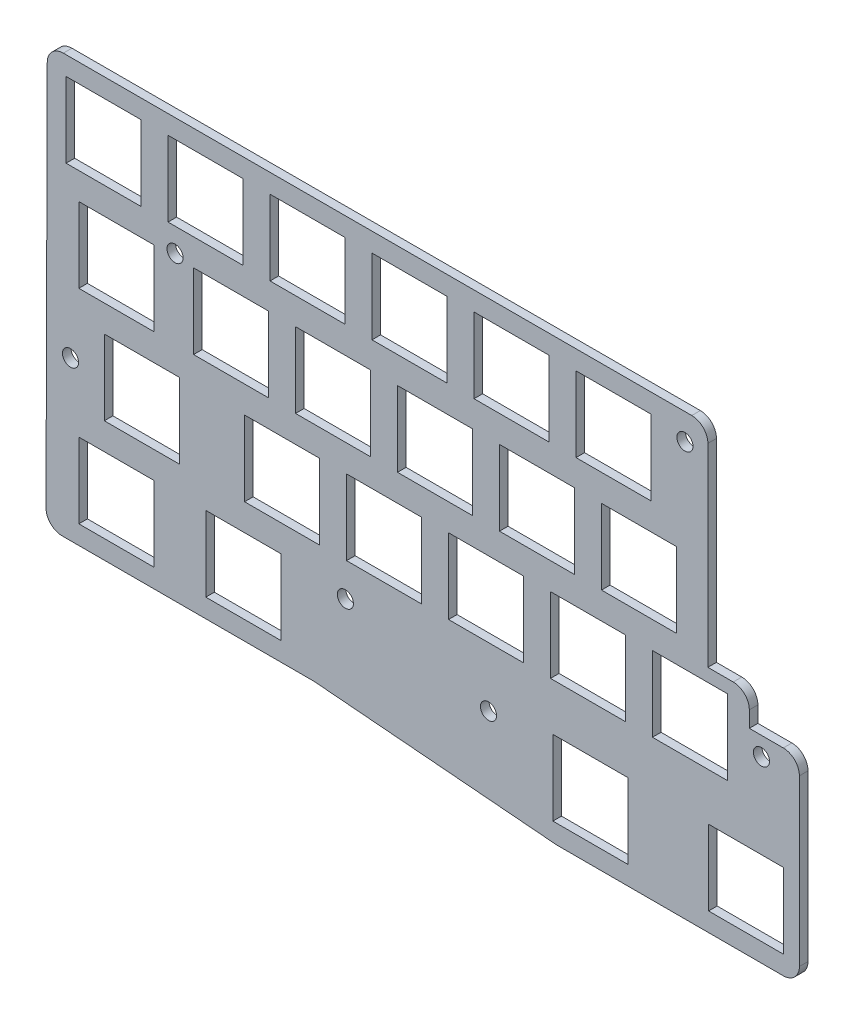
from build123d import *

# Parameters (mm, degrees)
SKETCH1_R           = 1.5
SKETCH1_W           = 14
SKETCH1_H           = 14
BOSS_EXTRUDE1_DEPTH = 1.6
CUT_EXTRUDE1_DEPTH  = 1.6
FILLET1_R           = 3


with BuildPart() as part:
    # Sketch1 → Boss-Extrude1 (new body)
    with BuildSketch(Plane.XY):
        with BuildLine():
            Line((69.256483633, 39.154946315), (-80.703110167, 39.058787515))
            ThreePointArc((-80.703110167, 39.058787515), (-82.819785745, 38.18282616), (-83.701171171, 36.068403419))
            Line((-83.701171171, 36.068403419), (-83.931946571, -35.933513481))
            ThreePointArc((-83.931946571, -35.933513481), (-83.056679124, -38.061046878), (-80.931961975, -38.943128786))
            Line((-80.931961975, -38.943128786), (-34.162352475, -38.943128786))
            ThreePointArc((-34.162352475, -38.943128786), (-34.036703471, -38.945761219), (-33.911274976, -38.953653901))
            Line((-33.911274976, -38.953653901), (11.083089424, -42.732603701))
            ThreePointArc((11.083089424, -42.732603701), (11.20851792, -42.740496382), (11.334166924, -42.743128815))
            Line((11.334166924, -42.743128815), (59.596129524, -42.743128815))
            ThreePointArc((59.596129524, -42.743128815), (61.35026035, -42.176855395), (62.442179406, -40.69181219))
            Line((62.442179406, -40.69181219), (72.104457106, -11.70497919))
            ThreePointArc((72.104457106, -11.70497919), (72.219669608, -11.236842575), (72.258407243, -10.756295796))
            Line((72.258407243, -10.756295796), (72.258407243, 36.154946904))
            ThreePointArc((72.258407243, 36.154946904), (71.379047386, 38.276947252), (69.256483633, 39.154946315))
        make_face()
        with Locations((35.108407229, 34.256871219)):
            Circle(SKETCH1_R, mode=Mode.SUBTRACT)
        with Locations((-28.161592771, -22.743128781)):
            Circle(SKETCH1_R, mode=Mode.SUBTRACT)
        with Locations((-1.491592771, -27.493128781)):
            Circle(SKETCH1_R, mode=Mode.SUBTRACT)
        with Locations((-79.366592771, -9.443128781)):
            Circle(SKETCH1_R, mode=Mode.SUBTRACT)
        with Locations((49.358407229, -9.443128781)):
            Circle(SKETCH1_R, mode=Mode.SUBTRACT)
        with Locations((-59.891592771, 17.156871219)):
            Circle(SKETCH1_R, mode=Mode.SUBTRACT)
        with Locations((2.808407229, 28.556871219)):
            Rectangle(SKETCH1_W, SKETCH1_H, mode=Mode.SUBTRACT)
        with Locations((21.808407229, 28.556871219)):
            Rectangle(SKETCH1_W, SKETCH1_H, mode=Mode.SUBTRACT)
        with Locations((-35.191592771, 28.556871219)):
            Rectangle(SKETCH1_W, SKETCH1_H, mode=Mode.SUBTRACT)
        with Locations((-16.191592771, 28.556871219)):
            Rectangle(SKETCH1_W, SKETCH1_H, mode=Mode.SUBTRACT)
        with Locations((-70.816592771, 9.556871219)):
            Rectangle(SKETCH1_W, SKETCH1_H, mode=Mode.SUBTRACT)
        with Locations((-49.441592771, 9.556871219)):
            Rectangle(SKETCH1_W, SKETCH1_H, mode=Mode.SUBTRACT)
        with Locations((-30.441592771, 9.556871219)):
            Rectangle(SKETCH1_W, SKETCH1_H, mode=Mode.SUBTRACT)
        with Locations((-11.441592771, 9.556871219)):
            Rectangle(SKETCH1_W, SKETCH1_H, mode=Mode.SUBTRACT)
        with Locations((-39.941592771, -9.443128781)):
            Rectangle(SKETCH1_W, SKETCH1_H, mode=Mode.SUBTRACT)
        with Locations((-1.941592771, -9.443128781)):
            Rectangle(SKETCH1_W, SKETCH1_H, mode=Mode.SUBTRACT)
        with Locations((26.558407229, 9.556871219)):
            Rectangle(SKETCH1_W, SKETCH1_H, mode=Mode.SUBTRACT)
        with Locations((36.058407229, -9.443128781)):
            Rectangle(SKETCH1_W, SKETCH1_H, mode=Mode.SUBTRACT)
        with Locations((17.508407229, -32.243128781)):
            Rectangle(SKETCH1_W, SKETCH1_H, mode=Mode.SUBTRACT)
        with Locations((-70.816592771, -28.443128781)):
            Rectangle(SKETCH1_W, SKETCH1_H, mode=Mode.SUBTRACT)
        with Locations((-73.191592771, 28.556871219)):
            Rectangle(SKETCH1_W, SKETCH1_H, mode=Mode.SUBTRACT)
        with Locations((-54.191592771, 28.556871219)):
            Rectangle(SKETCH1_W, SKETCH1_H, mode=Mode.SUBTRACT)
        with Locations((7.558407229, 9.556871219)):
            Rectangle(SKETCH1_W, SKETCH1_H, mode=Mode.SUBTRACT)
        with Locations((-66.066592771, -9.443128781)):
            Rectangle(SKETCH1_W, SKETCH1_H, mode=Mode.SUBTRACT)
        with Locations((-20.941592771, -9.443128781)):
            Rectangle(SKETCH1_W, SKETCH1_H, mode=Mode.SUBTRACT)
        with Locations((17.058407229, -9.443128781)):
            Rectangle(SKETCH1_W, SKETCH1_H, mode=Mode.SUBTRACT)
        with Locations((-47.161592771, -28.443128781)):
            Rectangle(SKETCH1_W, SKETCH1_H, mode=Mode.SUBTRACT)
        with Locations((46.508407229, -32.243128781)):
            Rectangle(SKETCH1_W, SKETCH1_H, mode=Mode.SUBTRACT)
    extrude(amount=BOSS_EXTRUDE1_DEPTH)

    # Sketch2 → Cut-Extrude1 (cut)
    with BuildSketch(Plane.XY.offset(1.6)):
        Polygon((39.377336656, 41.971884199), (39.377336656, 0), (47.100744033, 0), (47.100744033, -5.977603272), (56.433194615, -5.977603272), (56.433194615, -45.238257442), (88.453154369, -41.859266714), (93.4411883, 41.971884199), align=None)
    extrude(amount=-CUT_EXTRUDE1_DEPTH, mode=Mode.SUBTRACT)

    # Fillet1
    fillet1_edges = [part.edges().sort_by_distance(p)[0] for p in [
        (56.433194615, -42.743128815, 0.8),
        (56.433194615, -5.977603272, 0.8),
        (47.100744033, 0, 0.8),
        (39.377336656, 39.135786868, 0.8),
    ]]
    fillet(fillet1_edges, radius=FILLET1_R)


solid = part.part
